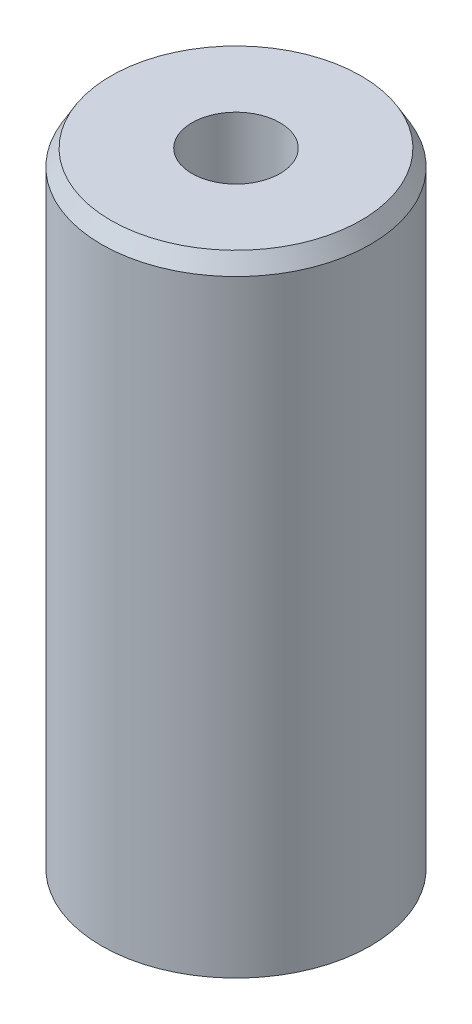
from build123d import *
from OCP.BRepFilletAPI import BRepFilletAPI_MakeChamfer

# Parameters (mm, degrees)
SKETCH1_R           = 7.5
BOSS_EXTRUDE1_DEPTH = 35.308407607
SKETCH2_R           = 2.457622699
CUT_EXTRUDE1_DEPTH  = 37.867107938
CHAMFER1_SIZE       = 0.902340498
CHAMFER1_SIZE2      = 0.52096653


with BuildPart() as part:
    # Sketch1 → Boss-Extrude1 (new body)
    with BuildSketch(Plane(origin=(0, 0, 0), x_dir=(1, 0, 0), z_dir=(0, 1, 0))):
        Circle(SKETCH1_R)
    extrude(amount=BOSS_EXTRUDE1_DEPTH)

    # Sketch2 → Cut-Extrude1 (cut, through all)
    with BuildSketch(Plane(origin=(0, 0, 0), x_dir=(1, 0, 0), z_dir=(0, 1, 0))):
        Circle(SKETCH2_R)
    extrude(amount=CUT_EXTRUDE1_DEPTH, mode=Mode.SUBTRACT)

    # Chamfer1: one chamfer whose edges measure the first distance from different faces: ONE call of the kernel's chamfer builder (chamfer() names one face for all edges)
    chamfer1_edges_1 = [part.edges().sort_by_distance(p)[0] for p in [
        (-7.5, 35.308407607, 0),
    ]]
    chamfer1_side_1 = [part.faces().sort_by_distance(p)[0] for p in [
        (-7.5, 17.654203803, 0),
    ]]
    chamfer1_edges_2 = [part.edges().sort_by_distance(p)[0] for p in [
        (-7.5, 0, 0),
    ]]
    chamfer1_side_2 = [part.faces().sort_by_distance(p)[0] for p in [
        (-7.287867966, 0, 0),
    ]]
    chamfer1 = BRepFilletAPI_MakeChamfer(part.part.solid().wrapped)
    for e in chamfer1_edges_1:
        chamfer1.Add(CHAMFER1_SIZE, CHAMFER1_SIZE2, e.wrapped, chamfer1_side_1[0].wrapped)  # the first distance lies on this face
    for e in chamfer1_edges_2:
        chamfer1.Add(CHAMFER1_SIZE, CHAMFER1_SIZE2, e.wrapped, chamfer1_side_2[0].wrapped)  # the first distance lies on this face
    add(Compound.cast(chamfer1.Shape()), mode=Mode.REPLACE)


solid = part.part
